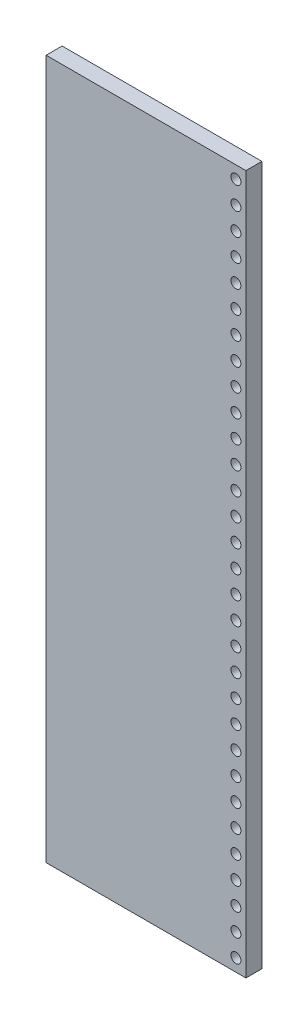
from build123d import *

# Parameters (mm, degrees)
SKETCH1_W           = 200
SKETCH1_H           = 700
BOSS_EXTRUDE1_DEPTH = 16
SKETCH2_OUTSIDE_W   = 347.638
SKETCH2_OUTSIDE_H   = 847.638
SKETCH2_OUTSIDE_R   = 5
CUT_EXTRUDE8_DEPTH  = 708.287777358
LPATTERN1_OUTLINE_R = 5
LPATTERN1_DEPTH     = 16


# Read off the part's stored shape, not the designer's step: LPattern1
with BuildPart() as part:
    # Sketch1 → Boss-Extrude1 (new body)
    with BuildSketch(Plane.XY):
        with Locations((0, 350)):
            Rectangle(SKETCH1_W, SKETCH1_H)
    extrude(amount=BOSS_EXTRUDE1_DEPTH)

    # Sketch2 outside → Cut-Extrude8 (cut, symmetric)
    # profile 1 of 2: a face of its own
    with BuildSketch(Plane.XY.offset(16)):
        with Locations((0, 350)):
            Rectangle(SKETCH2_OUTSIDE_W, SKETCH2_OUTSIDE_H)
        Polygon((90, 0), (100, 0), (100, 12.5), (100, 700), (-100, 700), (-100, 0), align=None, mode=Mode.SUBTRACT)
    # profile 2 of 2: a face of its own
    with BuildSketch(Plane.XY.offset(16)):
        with Locations(Location((90, 12.5, 0), (0, 0, 180))):
            Circle(SKETCH2_OUTSIDE_R)
    extrude(amount=CUT_EXTRUDE8_DEPTH, both=True, mode=Mode.SUBTRACT)

    # LPattern1 outline → LPattern1 (cut)
    with BuildSketch(Plane.XY):
        with Locations((90, 687.5)):
            Circle(LPATTERN1_OUTLINE_R)
        with Locations((90, 665)):
            Circle(LPATTERN1_OUTLINE_R)
        with Locations((90, 642.5)):
            Circle(LPATTERN1_OUTLINE_R)
        with Locations((90, 620)):
            Circle(LPATTERN1_OUTLINE_R)
        with Locations((90, 597.5)):
            Circle(LPATTERN1_OUTLINE_R)
        with Locations((90, 575)):
            Circle(LPATTERN1_OUTLINE_R)
        with Locations((90, 552.5)):
            Circle(LPATTERN1_OUTLINE_R)
        with Locations((90, 530)):
            Circle(LPATTERN1_OUTLINE_R)
        with Locations((90, 507.5)):
            Circle(LPATTERN1_OUTLINE_R)
        with Locations((90, 485)):
            Circle(LPATTERN1_OUTLINE_R)
        with Locations((90, 462.5)):
            Circle(LPATTERN1_OUTLINE_R)
        with Locations((90, 440)):
            Circle(LPATTERN1_OUTLINE_R)
        with Locations((90, 417.5)):
            Circle(LPATTERN1_OUTLINE_R)
        with Locations((90, 395)):
            Circle(LPATTERN1_OUTLINE_R)
        with Locations((90, 372.5)):
            Circle(LPATTERN1_OUTLINE_R)
        with Locations((90, 350)):
            Circle(LPATTERN1_OUTLINE_R)
        with Locations((90, 327.5)):
            Circle(LPATTERN1_OUTLINE_R)
        with Locations((90, 305)):
            Circle(LPATTERN1_OUTLINE_R)
        with Locations((90, 282.5)):
            Circle(LPATTERN1_OUTLINE_R)
        with Locations((90, 260)):
            Circle(LPATTERN1_OUTLINE_R)
        with Locations((90, 237.5)):
            Circle(LPATTERN1_OUTLINE_R)
        with Locations((90, 215)):
            Circle(LPATTERN1_OUTLINE_R)
        with Locations((90, 192.5)):
            Circle(LPATTERN1_OUTLINE_R)
        with Locations((90, 170)):
            Circle(LPATTERN1_OUTLINE_R)
        with Locations((90, 147.5)):
            Circle(LPATTERN1_OUTLINE_R)
        with Locations((90, 125)):
            Circle(LPATTERN1_OUTLINE_R)
        with Locations((90, 102.5)):
            Circle(LPATTERN1_OUTLINE_R)
        with Locations((90, 80)):
            Circle(LPATTERN1_OUTLINE_R)
        with Locations((90, 57.5)):
            Circle(LPATTERN1_OUTLINE_R)
        with Locations((90, 35)):
            Circle(LPATTERN1_OUTLINE_R)
    extrude(amount=LPATTERN1_DEPTH, mode=Mode.SUBTRACT)


solid = part.part
